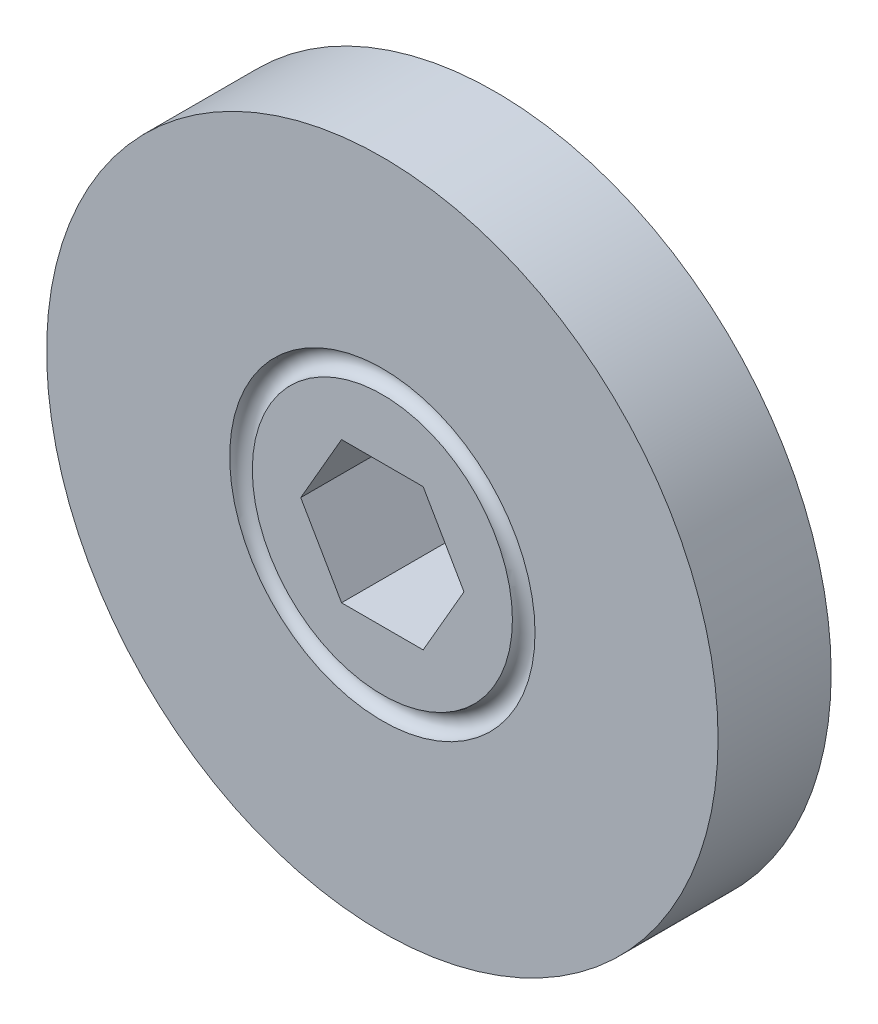
from build123d import *

# Parameters (mm, degrees)
CUT_EXTRUDE1_REACH = 45.849


with BuildPart() as part:
    # Sketch1 → Revolve1 (revolve)
    with BuildSketch(Plane(origin=(0, 0, 0), x_dir=(0, 0, -1), z_dir=(1, 0, 0))):
        with BuildLine():
            Line((-5.08, 30.1625), (5.08, 30.1625))
            Line((5.08, 30.1625), (5.08, 13.716))
            ThreePointArc((5.08, 13.716), (4.064, 12.7), (5.08, 11.684))
            Line((5.08, 11.684), (5.08, 0))
            Line((5.08, 0), (-5.08, 0))
            Line((-5.08, 0), (-5.08, 11.684))
            ThreePointArc((-5.08, 11.684), (-4.064, 12.7), (-5.08, 13.716))
            Line((-5.08, 13.716), (-5.08, 30.1625))
        make_face()
    revolve(axis=Axis((0, 0, 5.08), (0, 0, -1)))

    # Sketch2 → Cut-Extrude1 (cut, up to next)
    with BuildSketch(Plane.XY.offset(5.08), mode=Mode.PRIVATE) as cut_extrude1_sk1:
        Polygon((-3.666174209, 6.35), (-7.332348419, 0), (-3.666174209, -6.35), (3.666174209, -6.35), (7.332348419, 0), (3.666174209, 6.35), align=None)
    cut_extrude1_tool1 = extrude(cut_extrude1_sk1.sketch, amount=-CUT_EXTRUDE1_REACH, mode=Mode.PRIVATE) & part.part
    add(cut_extrude1_tool1.solids().sort_by_distance((0, 0, 5.08))[0], mode=Mode.SUBTRACT)


solid = part.part
